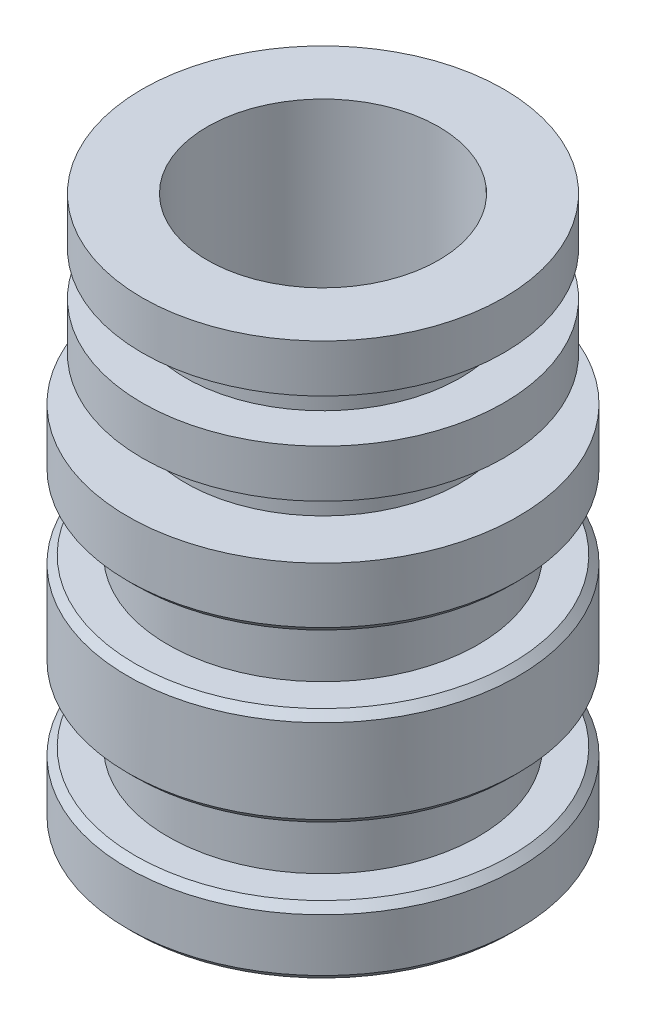
from build123d import *

# Parameters (mm, degrees)
ESQUISSE4_R             = 4
ENL_V_MAT_EXTRU_3_DEPTH = 43.347845282
CHANFREIN4_SIZE         = 0.5
CHANFREIN3_SIZE         = 0.5


with BuildPart() as part:
    # Esquisse1 → Révolution1 (revolve)
    with BuildSketch(Plane.XY):
        Polygon((0, 0), (-13.5, 0), (-13.5, 4.64), (-10.73, 4.64), (-10.73, 9.34), (-13.5, 9.34), (-13.5, 16.14), (-10.73, 16.14), (-10.73, 20.84), (-13.5, 20.84), (-13.5, 25.2), (-12.5, 25.2), (-9.5, 25.2), (-9.5, 28.2), (-12.5, 28.2), (-12.5, 31.5), (-9.5, 31.5), (-9.5, 34.5), (-12.5, 34.5), (-12.5, 37.8), (-8, 37.8), (-8, 20.84), (-8, 8), (0, 8), align=None)
    revolve(axis=Axis((0, -29.115408637, 0), (0, 1, 0)))

    # Esquisse4 → Enlèv. mat.-Extru.3 (cut, through all)
    with BuildSketch(Plane.XZ):
        Circle(ESQUISSE4_R)
    extrude(amount=-ENL_V_MAT_EXTRU_3_DEPTH, mode=Mode.SUBTRACT)

    # Chanfrein4
    chanfrein4_edges = [part.edges().sort_by_distance(p)[0] for p in [
        (-4, 8, 0),
        (-4, 0, 0),
    ]]
    chamfer(chanfrein4_edges, length=CHANFREIN4_SIZE)

    # Chanfrein3
    chanfrein3_edges = [part.edges().sort_by_distance(p)[0] for p in [
        (13.5, 0, 0),
        (13.5, 20.84, 0),
        (13.5, 16.14, 0),
        (13.5, 9.34, 0),
        (13.5, 4.64, 0),
    ]]
    chamfer(chanfrein3_edges, length=CHANFREIN3_SIZE)


solid = part.part
